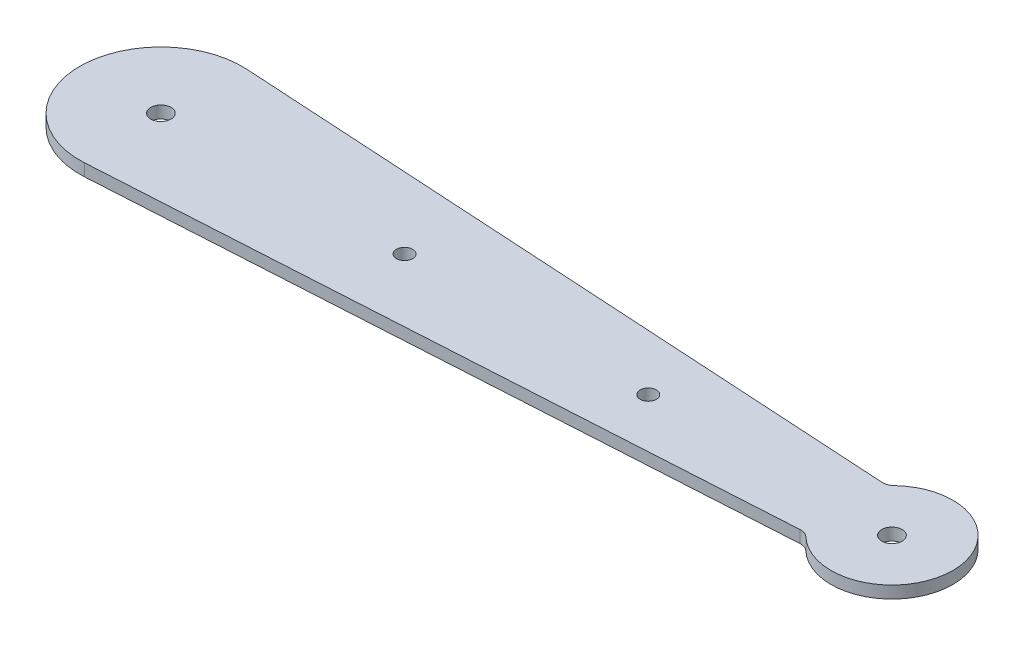
from build123d import *

# Parameters (mm, degrees)
SKETCH1_R           = 2.5
SKETCH1_R_2         = 2
BOSS_EXTRUDE1_DEPTH = 3
FILLET2_R           = 3
FILLET3_R           = 3


with BuildPart() as part:
    # Sketch1 → Boss-Extrude1 (new body)
    with BuildSketch(Plane(origin=(0, 0, 0), x_dir=(1, 0, 0), z_dir=(0, 1, 0))):
        with BuildLine():
            ThreePointArc((1.186783721, 19.964757559), (-20, 0), (1.186783721, -19.964757559))
            Line((1.186783721, -19.964757559), (168.819660113, -10))
            ThreePointArc((168.819660113, -10), (195, 0), (168.819660113, 10))
            Line((168.819660113, 10), (1.186783721, 19.964757559))
        make_face()
        Circle(SKETCH1_R, mode=Mode.SUBTRACT)
        with Locations((60, 0)):
            Circle(SKETCH1_R_2, mode=Mode.SUBTRACT)
        with Locations((120, 0)):
            Circle(SKETCH1_R_2, mode=Mode.SUBTRACT)
        with Locations((180, 0)):
            Circle(SKETCH1_R, mode=Mode.SUBTRACT)
    extrude(amount=BOSS_EXTRUDE1_DEPTH)

    # Fillet2
    fillet2_edges = [part.edges().sort_by_distance(p)[0] for p in [
        (168.819660113, 1.5, -10),
    ]]
    fillet(fillet2_edges, radius=FILLET2_R)

    # Fillet3
    fillet3_edges = [part.edges().sort_by_distance(p)[0] for p in [
        (168.819660113, 1.5, 10),
    ]]
    fillet(fillet3_edges, radius=FILLET3_R)


solid = part.part
